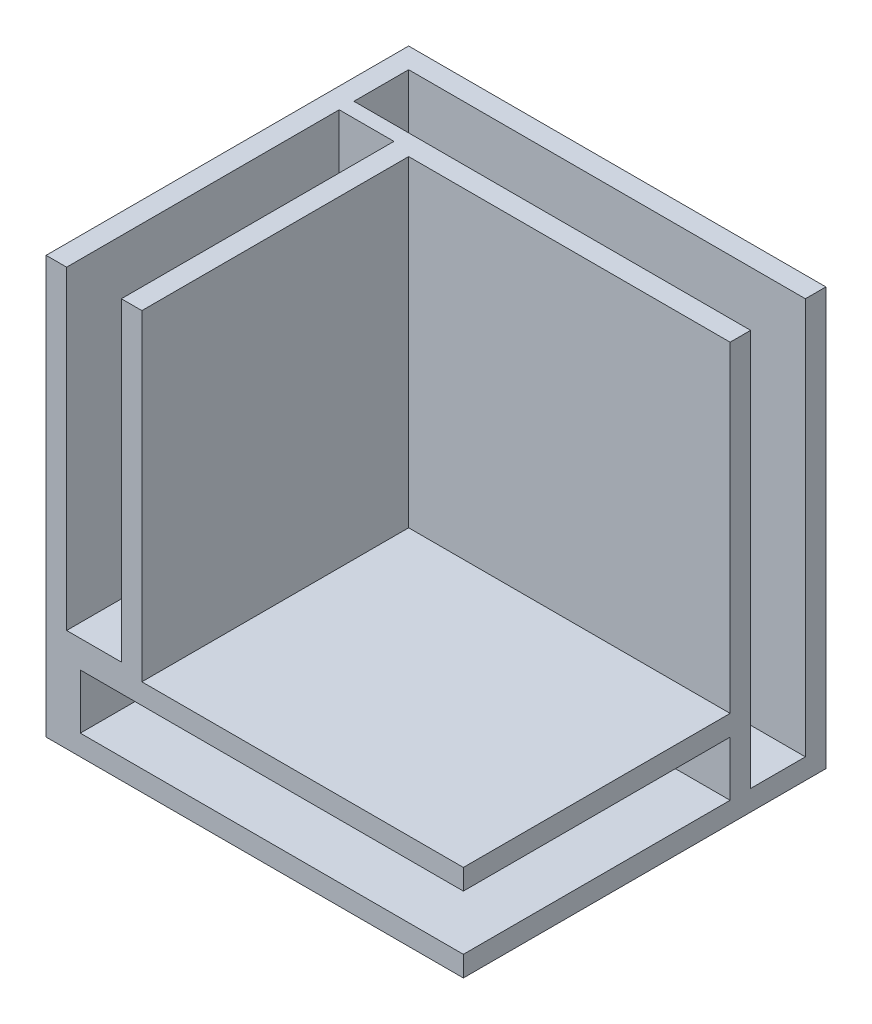
from build123d import *

# Parameters (mm, degrees)
SKETCH1_W            = 30
SKETCH1_H            = 30
BOSS_EXTRUDE1_DEPTH  = 6
BOSS_EXTRUDE4_DEPTH  = 20
SKETCH4_W            = 2
SKETCH4_H            = 2
BOSS_EXTRUDE6_DEPTH  = 20
SKETCH5_W            = 24
SKETCH5_H            = 6
BOSS_EXTRUDE7_DEPTH  = 20
SHELL2_START         = 7
SHELL2_DEPTH         = 23
SHELL2_START_2       = 1
SHELL2_2_DEPTH       = 4
SHELL2_START_3       = 5
SHELL2_3_OUTLINE_W   = 29
SHELL2_3_OUTLINE_H   = 4
SHELL2_3_DEPTH       = 2
SKETCH7_W            = 23
SKETCH7_H            = 1
BOSS_EXTRUDE8_DEPTH  = 5
SKETCH9_W            = 1.075143629
SKETCH9_H            = 23
BOSS_EXTRUDE9_DEPTH  = 5
SKETCH10_W           = 4
SKETCH10_H           = 23
CUT_EXTRUDE1_DEPTH   = 10
SKETCH11_W           = 23
SKETCH11_H           = 4
CUT_EXTRUDE2_DEPTH   = 10
BOSS_EXTRUDE10_DEPTH = 20
SKETCH13_W           = 20
SKETCH13_H           = 4
CUT_EXTRUDE3_DEPTH   = 5
SKETCH14_W           = 30
SKETCH14_H           = 26
BOSS_EXTRUDE11_DEPTH = 0.5
SKETCH15_W           = 26
SKETCH15_H           = 30.5
BOSS_EXTRUDE12_DEPTH = 0.5
SKETCH16_W           = 20
SKETCH16_H           = 24
BOSS_EXTRUDE13_DEPTH = 0.5
SKETCH19_W           = 30.5
SKETCH19_H           = 30.5
BOSS_EXTRUDE14_DEPTH = 0.5
SKETCH20_W           = 23.5
SKETCH20_H           = 24
BOSS_EXTRUDE15_DEPTH = 0.5
SKETCH21_W           = 23.5
SKETCH21_H           = 19.5
BOSS_EXTRUDE16_DEPTH = 0.5
SKETCH25_W           = 28
SKETCH25_H           = 4
BOSS_EXTRUDE17_DEPTH = 0.5


# Read off the part's stored shape, not the designer's step: Shell2
with BuildPart() as part:
    # Sketch1 → Boss-Extrude1 (new body)
    with BuildSketch(Plane.XY):
        with Locations((15, 15)):
            Rectangle(SKETCH1_W, SKETCH1_H)
    extrude(amount=BOSS_EXTRUDE1_DEPTH)

    # Sketch2 → Boss-Extrude4 (add)
    with BuildSketch(Plane.XY.offset(6)):
        Polygon((5, 6), (6, 6), (6, 30), (0, 30), (0, 6), align=None)
    extrude(amount=BOSS_EXTRUDE4_DEPTH)

    # Sketch4 → Boss-Extrude6 (add)
    with BuildSketch(Plane.XY.offset(6)):
        with Locations((5, 5)):
            Rectangle(SKETCH4_W, SKETCH4_H)
    extrude(amount=BOSS_EXTRUDE6_DEPTH)

    # Sketch5 → Boss-Extrude7 (add)
    with BuildSketch(Plane.XY.offset(6)):
        with Locations((18, 3)):
            Rectangle(SKETCH5_W, SKETCH5_H)
    extrude(amount=BOSS_EXTRUDE7_DEPTH)

    # Shell2 outline → Shell2 (cut)
    with BuildSketch(Plane(origin=(0, 0, 0), x_dir=(1, 0, 0), z_dir=(0, 1, 0)).offset(SHELL2_START)):
        Polygon((5, -5), (30, -5), (30, -1), (1, -1), (1, -25), (5, -25), align=None)
    extrude(amount=SHELL2_DEPTH, mode=Mode.SUBTRACT)

    # Shell2 2 outline → Shell2 2 (cut)
    with BuildSketch(Plane(origin=(0, 0, 0), x_dir=(1, 0, 0), z_dir=(0, 1, 0)).offset(SHELL2_START_2)):
        Polygon((7, -5), (7, -25), (30, -25), (30, -1), (1, -1), (1, -5), align=None)
    extrude(amount=SHELL2_2_DEPTH, mode=Mode.SUBTRACT)

    # Shell2 3 outline → Shell2 3 (cut)
    with BuildSketch(Plane(origin=(0, 0, 0), x_dir=(1, 0, 0), z_dir=(0, 1, 0)).offset(SHELL2_START_3)):
        with Locations((15.5, -3)):
            Rectangle(SHELL2_3_OUTLINE_W, SHELL2_3_OUTLINE_H)
    extrude(amount=SHELL2_3_DEPTH, mode=Mode.SUBTRACT)

    # Sketch7 → Boss-Extrude8 (add)
    with BuildSketch(Plane.XZ.offset(-5)):
        with Locations((18.5, 5.5)):
            Rectangle(SKETCH7_W, SKETCH7_H)
    extrude(amount=BOSS_EXTRUDE8_DEPTH)

    # Sketch9 → Boss-Extrude9 (add)
    with BuildSketch(Plane.ZY.offset(-5)):
        with Locations((5.537571814, 18.5)):
            Rectangle(SKETCH9_W, SKETCH9_H)
    extrude(amount=BOSS_EXTRUDE9_DEPTH)

    # Sketch10 → Cut-Extrude1 (cut)
    with BuildSketch(Plane.XY.offset(26)):
        with Locations((3, 18.5)):
            Rectangle(SKETCH10_W, SKETCH10_H)
    extrude(amount=-CUT_EXTRUDE1_DEPTH, mode=Mode.SUBTRACT)

    # Sketch11 → Cut-Extrude2 (cut)
    with BuildSketch(Plane.XY.offset(26)):
        with Locations((18.5, 3)):
            Rectangle(SKETCH11_W, SKETCH11_H)
    extrude(amount=-CUT_EXTRUDE2_DEPTH, mode=Mode.SUBTRACT)

    # Sketch12 → Boss-Extrude10 (add)
    with BuildSketch(Plane.XY.offset(6)):
        Polygon((6, 0), (6, 4), (4, 4), (4, 6), (0, 6), (0, 0), align=None)
    extrude(amount=BOSS_EXTRUDE10_DEPTH)

    # Sketch13 → Cut-Extrude3 (cut)
    with BuildSketch(Plane(origin=(7, 0, 0), x_dir=(0, 0, -1), z_dir=(1, 0, 0))):
        with Locations((-16, 3)):
            Rectangle(SKETCH13_W, SKETCH13_H)
    extrude(amount=-CUT_EXTRUDE3_DEPTH, mode=Mode.SUBTRACT)

    # Sketch14 → Boss-Extrude11 (add)
    with BuildSketch(Plane.XZ):
        with Locations((15, 13)):
            Rectangle(SKETCH14_W, SKETCH14_H)
    extrude(amount=BOSS_EXTRUDE11_DEPTH)

    # Sketch15 → Boss-Extrude12 (add)
    with BuildSketch(Plane.ZY):
        with Locations((13, 14.75)):
            Rectangle(SKETCH15_W, SKETCH15_H)
    extrude(amount=BOSS_EXTRUDE12_DEPTH)

    # Sketch16 → Boss-Extrude13 (add)
    with BuildSketch(Plane(origin=(6, 0, 0), x_dir=(0, 0, -1), z_dir=(1, 0, 0))):
        with Locations((-16, 18)):
            Rectangle(SKETCH16_W, SKETCH16_H)
    extrude(amount=BOSS_EXTRUDE13_DEPTH)

    # Sketch19 → Boss-Extrude14 (add)
    with BuildSketch(Plane(origin=(0, 0, 0), x_dir=(-1, 0, 0), z_dir=(0, 0, -1))):
        with Locations((-14.75, 14.75)):
            Rectangle(SKETCH19_W, SKETCH19_H)
    extrude(amount=BOSS_EXTRUDE14_DEPTH)

    # Sketch20 → Boss-Extrude15 (add)
    with BuildSketch(Plane.XY.offset(6)):
        with Locations((18.25, 18)):
            Rectangle(SKETCH20_W, SKETCH20_H)
    extrude(amount=BOSS_EXTRUDE15_DEPTH)

    # Sketch21 → Boss-Extrude16 (add)
    with BuildSketch(Plane(origin=(0, 6, 0), x_dir=(1, 0, 0), z_dir=(0, 1, 0))):
        with Locations((18.25, -16.25)):
            Rectangle(SKETCH21_W, SKETCH21_H)
    extrude(amount=BOSS_EXTRUDE16_DEPTH)

    # Sketch25 → Boss-Extrude17 (add)
    with BuildSketch(Plane.XY.offset(6)):
        with Locations((16, 3)):
            Rectangle(SKETCH25_W, SKETCH25_H)
    extrude(amount=BOSS_EXTRUDE17_DEPTH)


solid = part.part
